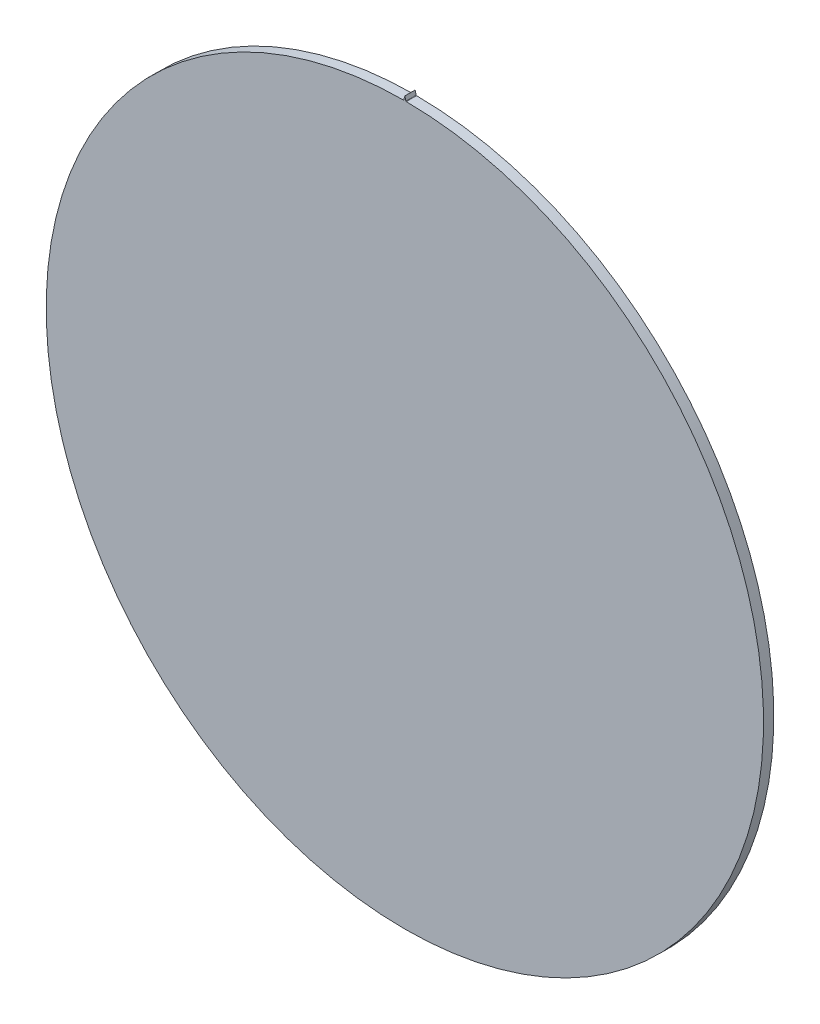
from build123d import *

# Parameters (mm, degrees)
TOOTH_DEPTH = 10


with BuildPart() as part:
    # Sketch1 (on Front Plane) → Tooth (new body)
    with BuildSketch(Plane.XY):
        with BuildLine():
            Line((1.022055543, 349.053309933), (1.023772414, 349.046673403))
            add(Edge.make_bspline(
                [(1.023772414, 349.046673403), (1.025578857, 349.039367158), (1.029363612, 349.026168664), (1.036088464, 349.005930099), (1.044582203, 348.984022436), (1.057243211, 348.956579272), (1.077332383, 348.921228299), (1.111146968, 348.8753174), (1.203838486, 348.786123892), (1.313226036, 348.746948966), (1.397883489, 348.747198443)],
                knots=[0, 0, 0, 0, 0.043833506, 0.079939833, 0.124187196, 0.180620643, 0.255829387, 0.360641089, 0.511698593, 1, 1, 1, 1], degree=3))
            ThreePointArc((1.397883489, 348.747198443), (0, -348.75), (-1.397883489, 348.747198443))
            add(Edge.make_bspline(
                [(-1.023772414, 349.046673403), (-1.025578857, 349.039367158), (-1.029363612, 349.026168664), (-1.036088464, 349.005930099), (-1.044582203, 348.984022436), (-1.057243211, 348.956579272), (-1.077332383, 348.921228299), (-1.111146968, 348.8753174), (-1.203838486, 348.786123892), (-1.313226036, 348.746948966), (-1.397883489, 348.747198443)],
                knots=[0, 0, 0, 0, 0.043833506, 0.079939833, 0.124187196, 0.180620643, 0.255829387, 0.360641089, 0.511698593, 1, 1, 1, 1], degree=3))
            Line((-1.023772414, 349.046673403), (-1.022055543, 349.053309933))
            add(Edge.make_bspline(
                [(0, 352.869005618), (-0.078232274, 352.599791154), (-0.192981437, 352.198529985), (-0.34132972, 351.666617724), (-0.448333975, 351.276418011), (-0.551988004, 350.891907379), (-0.652343171, 350.513107426), (-0.749450979, 350.140039413), (-0.873615316, 349.654399425), (-0.963620125, 349.292664319), (-1.022055543, 349.053309933)],
                knots=[0, 0, 0, 0, 0.212897122, 0.316927473, 0.419345683, 0.520151754, 0.619345683, 0.716927473, 0.812897122, 1, 1, 1, 1], degree=3))
            add(Edge.make_bspline(
                [(0, 352.869005618), (0.078232274, 352.599791154), (0.192981437, 352.198529985), (0.34132972, 351.666617724), (0.448333975, 351.276418011), (0.551988004, 350.891907379), (0.652343171, 350.513107426), (0.749450979, 350.140039413), (0.873615316, 349.654399425), (0.963620125, 349.292664319), (1.022055543, 349.053309933)],
                knots=[0, 0, 0, 0, 0.212897122, 0.316927473, 0.419345683, 0.520151754, 0.619345683, 0.716927473, 0.812897122, 1, 1, 1, 1], degree=3))
        make_face()
    extrude(amount=TOOTH_DEPTH)


solid = part.part
